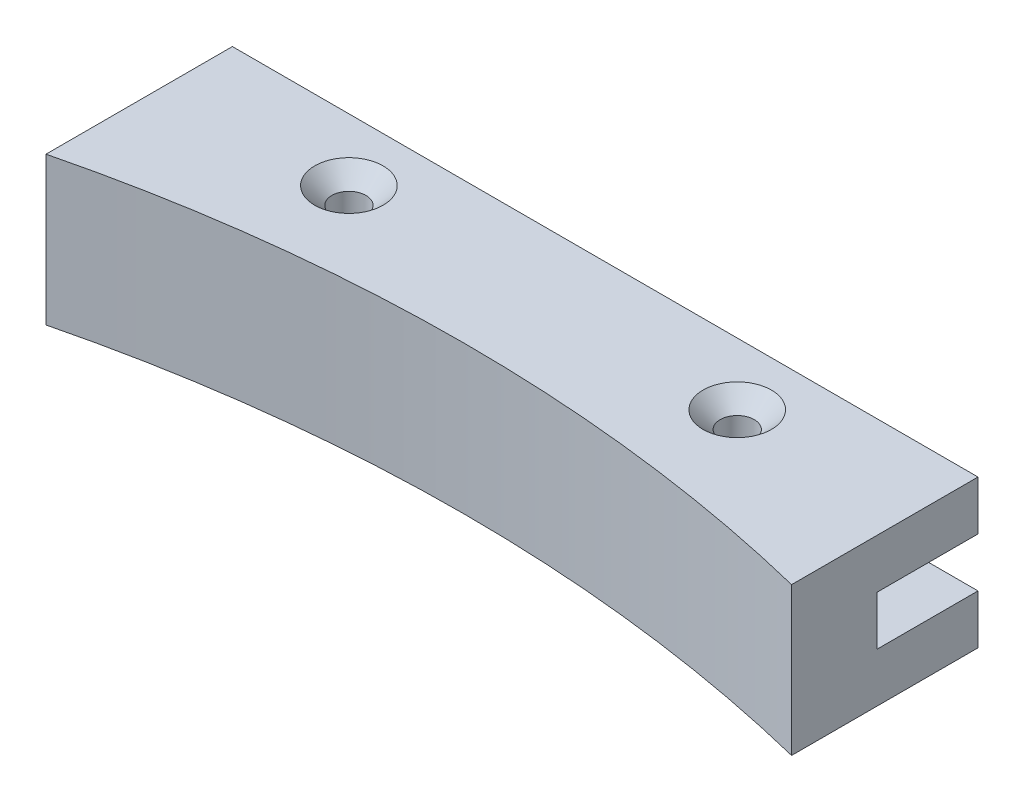
from build123d import *

# Parameters (mm, degrees)
BOSS_EXTRUDE1_DEPTH                             = 4.7625
CSK_FOR_M2_FLAT_HEAD_MACHINE_SCREW1_D           = 2.2
CSK_FOR_M2_FLAT_HEAD_MACHINE_SCREW1_CSINK_D     = 4.4
CSK_FOR_M2_FLAT_HEAD_MACHINE_SCREW1_CSINK_ANGLE = 90
SKETCH9_W                                       = 6.5
SKETCH9_H                                       = 3.175
CUT_EXTRUDE2_DEPTH                              = 50.705949405


with BuildPart() as part:
    # Sketch1 → Boss-Extrude1 (new, symmetric)
    with BuildSketch(Plane(origin=(0, 0, 0), x_dir=(1, 0, 0), z_dir=(0, 1, 0))):
        with BuildLine():
            Line((-24, 0), (24, 0))
            Line((24, 0), (24, -12))
            ThreePointArc((24, -12), (0, -9.077288796), (-24, -12))
            Line((-24, -12), (-24, 0))
        make_face()
    extrude(amount=BOSS_EXTRUDE1_DEPTH, both=True)

    # CSK for M2 Flat Head Machine Screw1 (through all)
    with Locations(Plane(origin=(0, 4.7625, 0), x_dir=(1, 0, 0), z_dir=(0, 1, 0))):
        with Locations((12.5, -4), (-12.5, -4)):
            CounterSinkHole(CSK_FOR_M2_FLAT_HEAD_MACHINE_SCREW1_D / 2, CSK_FOR_M2_FLAT_HEAD_MACHINE_SCREW1_CSINK_D / 2, counter_sink_angle=CSK_FOR_M2_FLAT_HEAD_MACHINE_SCREW1_CSINK_ANGLE)

    # Sketch9 → Cut-Extrude2 (cut, through all)
    with BuildSketch(Plane.ZY.offset(24)):
        with Locations((3.25, 0)):
            Rectangle(SKETCH9_W, SKETCH9_H)
    extrude(amount=-CUT_EXTRUDE2_DEPTH, mode=Mode.SUBTRACT)


solid = part.part
